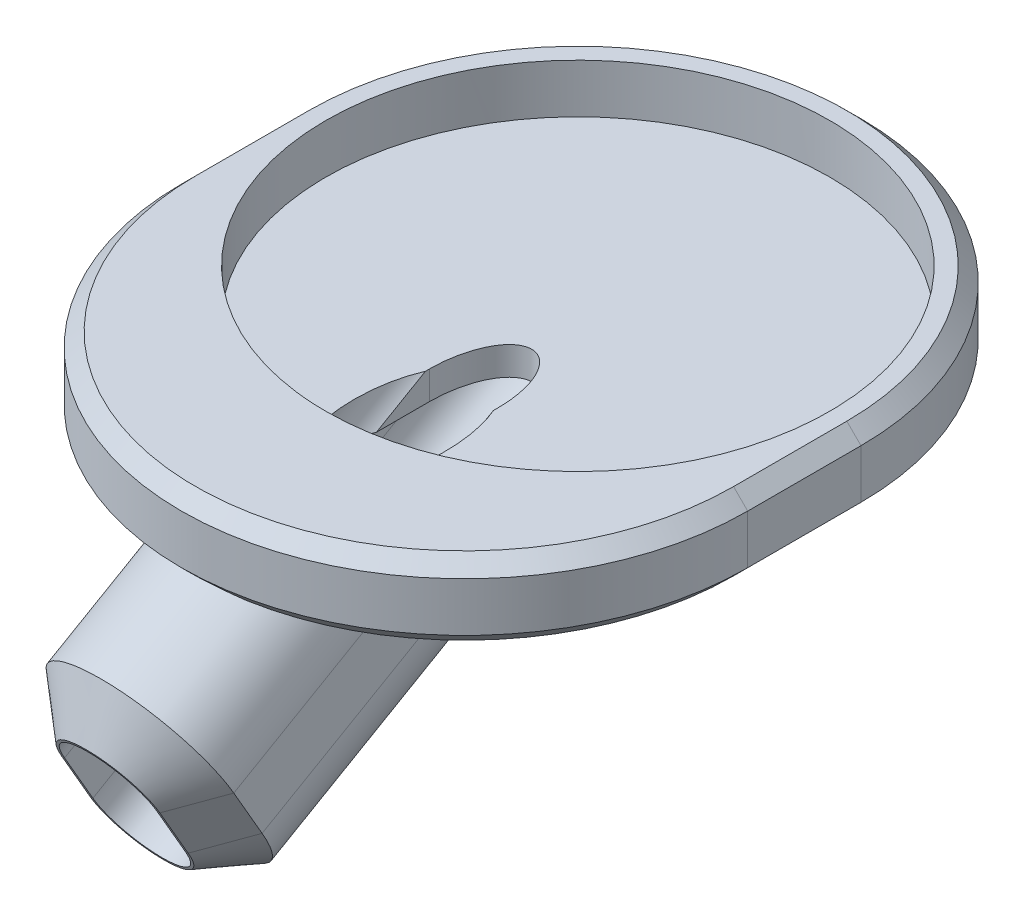
from build123d import *

# Parameters (mm, degrees)
BOSS_EXTRUDE1_DEPTH     = 5.5
BOSS_EXTRUDE2_START     = -3.175
BOSS_EXTRUDE2_DEPTH     = 3.175
BOSS_EXTRUDE4_REACH     = 95.106
CUT_EXTRUDE1_DEPTH      = 2.54
CUT_EXTRUDE1_DEPTH_BACK = 12.7
CUT_EXTRUDE2_REACH      = 73.925
SKETCH7_R               = 5.08
CUT_EXTRUDE4_DEPTH      = 19.05
CHAMFER3_SIZE           = 4.445
CHAMFER4_SIZE           = 1.5875


with BuildPart() as part:
    # Sketch1 → Boss-Extrude1 (new body)
    # profile 1 of 2: a face of its own
    with BuildSketch(Plane(origin=(0, 0, 0), x_dir=(1, 0, 0), z_dir=(0, 1, 0))):
        with BuildLine():
            Line((31.75, -12.7), (31.75, 0))
            ThreePointArc((31.75, 0), (0, 31.75), (-31.75, 0))
            Line((-31.75, 0), (-31.75, -12.7))
            ThreePointArc((-31.75, -12.7), (0, -44.45), (31.75, -12.7))
        make_face()
        with BuildLine():
            ThreePointArc((2.5, -40.108217228), (0, -42.608217228), (-2.5, -40.108217228))
            Line((-2.5, -40.108217228), (-2.5, -28.139163101))
            ThreePointArc((-2.5, -28.139163101), (-19.071411851, 20.840915287), (28.25, 0))
            ThreePointArc((28.25, 0), (20.840915287, -19.071411851), (2.5, -28.139163101))
            Line((2.5, -28.139163101), (2.5, -40.108217228))
        make_face(mode=Mode.SUBTRACT)
    # profile 2 of 2: a face of its own
    with BuildSketch(Plane(origin=(0, 0, 0), x_dir=(1, 0, 0), z_dir=(0, 1, 0))):
        with BuildLine():
            Line((-2.5, -28.139163101), (-2.5, -40.108217228))
            ThreePointArc((-2.5, -40.108217228), (0, -42.608217228), (2.5, -40.108217228))
            Line((2.5, -40.108217228), (2.5, -28.139163101))
            ThreePointArc((2.5, -28.139163101), (0, -28.25), (-2.5, -28.139163101))
        make_face()
    extrude(amount=BOSS_EXTRUDE1_DEPTH)

    # Sketch1<3> → Boss-Extrude2 (add)
    with BuildSketch(Plane(origin=(0, 0, 0), x_dir=(1, 0, 0), z_dir=(0, 1, 0)).offset(BOSS_EXTRUDE2_START)):
        with BuildLine():
            Line((31.75, 0), (31.75, -12.7))
            ThreePointArc((31.75, -12.7), (0, -44.45), (-31.75, -12.7))
            Line((-31.75, -12.7), (-31.75, 0))
            ThreePointArc((-31.75, 0), (0, 31.75), (31.75, 0))
        make_face()
    extrude(amount=BOSS_EXTRUDE2_DEPTH)

    # Sketch9 → Boss-Extrude4 (add, up to next)
    with BuildSketch(Plane(origin=(0, -18.686909051, 52.366675913), x_dir=(1, 0, 0), z_dir=(-1.7076979057767106e-15, 0.4999999999999981, -0.8660254037844397)), mode=Mode.PRIVATE) as boss_extrude4_sk1:
        with BuildLine():
            Line((9.9425, 6.35), (9.9425, 0))
            ThreePointArc((9.9425, 0), (0, -9.9425), (-9.9425, 0))
            Line((-9.9425, 0), (-9.9425, 6.35))
            ThreePointArc((-9.9425, 6.35), (0, 16.2925), (9.9425, 6.35))
        make_face()
        with BuildLine():
            Line((5.18, 6.35), (5.18, 0))
            ThreePointArc((5.18, 0), (0, -5.18), (-5.18, 0))
            Line((-5.18, 0), (-5.18, 6.35))
            ThreePointArc((-5.18, 6.35), (0, 11.53), (5.18, 6.35))
        make_face(mode=Mode.SUBTRACT)
    boss_extrude4_tool1 = extrude(boss_extrude4_sk1.sketch, amount=BOSS_EXTRUDE4_REACH, mode=Mode.PRIVATE) - part.part
    add(boss_extrude4_tool1.solids().sort_by_distance((-9.613306, -21.43654, 50.779176))[0])

    # Sketch1<5> → Cut-Extrude1 (cut, two sides: drawn at the far end of the back side and taken through both)
    with BuildSketch(Plane(origin=(0, 0, 0), x_dir=(1, 0, 0), z_dir=(0, 1, 0)).offset(-CUT_EXTRUDE1_DEPTH_BACK)):
        with BuildLine():
            Line((-2.5, -28.139163101), (-2.5, -40.108217228))
            ThreePointArc((-2.5, -40.108217228), (0, -42.608217228), (2.5, -40.108217228))
            Line((2.5, -40.108217228), (2.5, -28.139163101))
            ThreePointArc((2.5, -28.139163101), (0, -28.25), (-2.5, -28.139163101))
        make_face()
    extrude(amount=CUT_EXTRUDE1_DEPTH + CUT_EXTRUDE1_DEPTH_BACK, mode=Mode.SUBTRACT)

    # Cut-Extrude2: up to this face of the body (flat: up to its plane)
    cut_extrude2_end = Plane(part.part.faces().sort_by_distance((0, 2.54, 35.153591808))[0])
    # Sketch6 → Cut-Extrude2 (cut, up to the picked face)
    with BuildSketch(Plane.XZ.offset(3.175), mode=Mode.PRIVATE) as cut_extrude2_sk1:
        with BuildLine():
            Line((3.81, 12.799261314), (3.81, 25.499261314))
            add(Edge.make_bspline(
                [(3.81, 25.499261314), (3.81, 33.119261314), (0, 33.119261314), (-3.81, 33.119261314), (-3.81, 25.499261314)],
                knots=[4.71238898, 4.71238898, 4.71238898, 6.283185307, 6.283185307, 7.853981634, 7.853981634, 7.853981634], degree=2, weights=[1, 0.707106781, 1, 0.707106781, 1]))
            Line((-3.81, 25.499261314), (-3.81, 12.799261314))
            add(Edge.make_bspline(
                [(-3.81, 12.799261314), (-3.81, 5.179261314), (0, 5.179261314), (3.81, 5.179261314), (3.81, 12.799261314)],
                knots=[1.570796327, 1.570796327, 1.570796327, 3.141592654, 3.141592654, 4.71238898, 4.71238898, 4.71238898], degree=2, weights=[1, 0.707106781, 1, 0.707106781, 1]))
        make_face()
    cut_extrude2_tool1 = split(extrude(cut_extrude2_sk1.sketch, amount=-CUT_EXTRUDE2_REACH, mode=Mode.PRIVATE), bisect_by=cut_extrude2_end, keep=Keep.BOTH, mode=Mode.PRIVATE)
    add(cut_extrude2_tool1.solids().sort_by(Axis((0, -3.175, 19.149261), (0, 1, 0)))[0], mode=Mode.SUBTRACT)

    # Sketch7 → Cut-Extrude4 (cut)
    with BuildSketch(Plane(origin=(0, -3.534663089, 6.122216058), x_dir=(-1, 0, 0), z_dir=(-1.5543122344752196e-15, 0.49999999999999956, -0.8660254037844389))):
        with Locations((0, 10)):
            Circle(SKETCH7_R)
    extrude(amount=-CUT_EXTRUDE4_DEPTH, mode=Mode.SUBTRACT)

    # Chamfer3
    chamfer3_edges = [part.edges().sort_by_distance(p)[0] for p in [
        (-9.9425, -21.436539708, 50.779175913),
        (0, -32.796627942, 44.220425913),
        (0, -10.076451474, 57.337925913),
        (9.9425, -21.436539708, 50.779175913),
    ]]
    chamfer(chamfer3_edges, length=CHAMFER3_SIZE)

    # Chamfer4
    # the kernel refuses this chamfer: 1.5875 mm, written as the material it takes off along each edge
    with BuildSketch(Plane(origin=(0, -3.175, 12.7), x_dir=(0.025619349712622985, 0, 0.9996717705928794), z_dir=(0.9996717705928794, 0, -0.025619349712622985))) as chamfer4_piece_1_section:
        Polygon((31.75 - CHAMFER4_SIZE, 0), (31.75, -CHAMFER4_SIZE), (31.75, 0), align=None)
    chamfer4_piece_1 = revolve(axis=Axis((0, -3.175, 12.7), (0, -1, 0)), revolution_arc=91.468041234, mode=Mode.PRIVATE)
    chamfer4_piece_1 = chamfer4_piece_1 - Plane(origin=(0, -7.049278044, 32.20970773), x_dir=(1, 0, 0), z_dir=(1.7076979057767106e-15, -0.4999999999999981, 0.8660254037844397)) * Cylinder(9.9425, 127, mode=Mode.PRIVATE)
    add(chamfer4_piece_1, mode=Mode.SUBTRACT)
    with BuildSketch(Plane(origin=(31.75, -3.175, 0), x_dir=(-0.9996219169112966, -0.02749587661058651, 0), z_dir=(0, 0, 1)), Plane(origin=(-31.75, -3.175, 12.7), x_dir=(0.9996219169112966, -0.02749587661058651, 0), z_dir=(0, 0, -1))) as chamfer4_piece_2:
        Polygon((CHAMFER4_SIZE * 0.999621916911, -CHAMFER4_SIZE * 0.0274958766106), (-CHAMFER4_SIZE * 0.0274958766106, -CHAMFER4_SIZE * 0.999621916911), (0, 0), align=None)
    extrude(amount=12.7, mode=Mode.SUBTRACT)
    with BuildSketch(Plane(origin=(0, -3.175, 0), x_dir=(-1, 0, 0), z_dir=(0, 0, 1))) as chamfer4_piece_3:
        Polygon((31.75 - CHAMFER4_SIZE, 0), (31.75, -CHAMFER4_SIZE), (31.75, 0), align=None)
    revolve(axis=Axis((0, -3.175, 0), (0, -1, 0)), revolution_arc=180, mode=Mode.SUBTRACT)
    with BuildSketch(Plane(origin=(0, 5.5, 0), x_dir=(1, 0, 0), z_dir=(0, 0, 1))) as chamfer4_piece_4:
        Polygon((31.75, -CHAMFER4_SIZE), (31.75 - CHAMFER4_SIZE, 0), (31.75, 0), align=None)
    revolve(axis=Axis((0, 5.5, 0), (0, 1, 0)), revolution_arc=180, mode=Mode.SUBTRACT)
    with BuildSketch(Plane(origin=(-31.75, 5.5, 0), x_dir=(-0.027495876610585654, -0.9996219169112968, 0), z_dir=(0, 0, 1)), Plane(origin=(31.75, 5.5, 12.7), x_dir=(0.027495876610585654, -0.9996219169112968, 0), z_dir=(0, 0, -1))) as chamfer4_piece_5:
        Polygon((CHAMFER4_SIZE * 0.999621916911, CHAMFER4_SIZE * 0.0274958766106), (-CHAMFER4_SIZE * 0.0274958766106, CHAMFER4_SIZE * 0.999621916911), (0, 0), align=None)
    extrude(amount=12.7, mode=Mode.SUBTRACT)
    with BuildSketch(Plane(origin=(0, 5.5, 12.7), x_dir=(-1, 0, 0), z_dir=(0, 0, -1))) as chamfer4_piece_6:
        Polygon((31.75, -CHAMFER4_SIZE), (31.75 - CHAMFER4_SIZE, 0), (31.75, 0), align=None)
    revolve(axis=Axis((0, 5.5, 12.7), (0, 1, 0)), revolution_arc=180, mode=Mode.SUBTRACT)
    with BuildSketch(Plane(origin=(0, -3.175, 12.7), x_dir=(1, 0, 0), z_dir=(0, 0, -1))) as chamfer4_piece_7_section:
        Polygon((31.75 - CHAMFER4_SIZE, 0), (31.75, -CHAMFER4_SIZE), (31.75, 0), align=None)
    chamfer4_piece_7 = revolve(axis=Axis((0, -3.175, 12.7), (0, -1, 0)), revolution_arc=91.468041234, mode=Mode.PRIVATE)
    chamfer4_piece_7 = chamfer4_piece_7 - Plane(origin=(0, -7.049278047, 32.209707734), x_dir=(1, 0, 0), z_dir=(1.7076979057767106e-15, -0.4999999999999981, 0.8660254037844397)) * Cylinder(9.9425, 127, mode=Mode.PRIVATE)
    add(chamfer4_piece_7, mode=Mode.SUBTRACT)


solid = part.part
